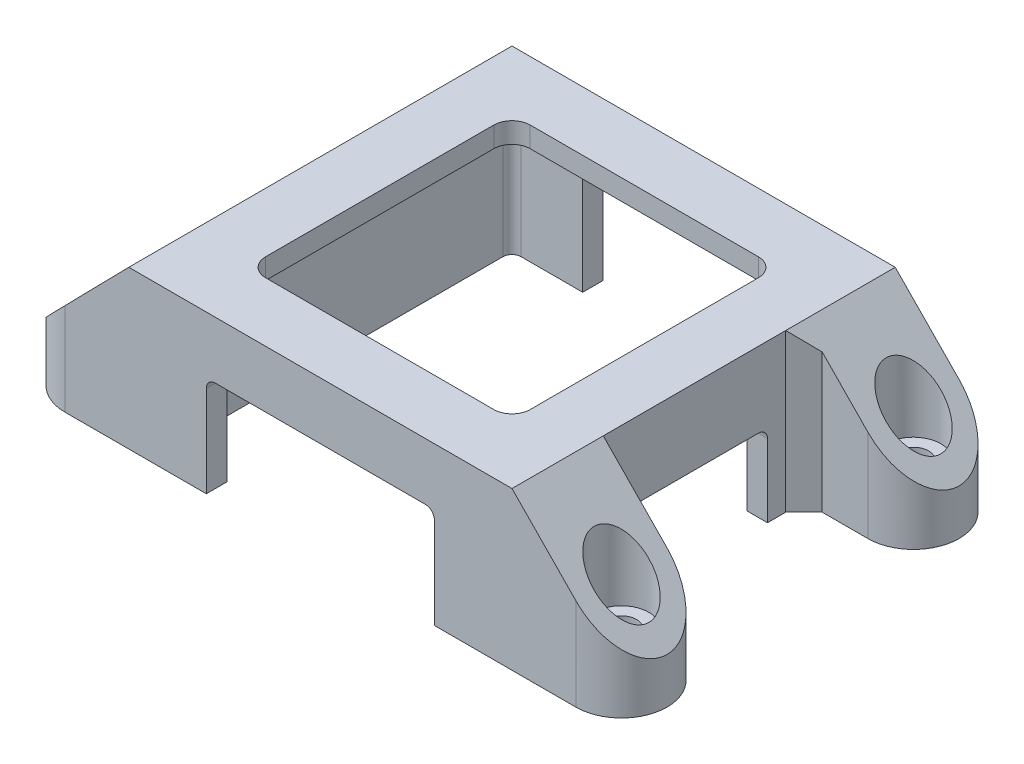
from build123d import *

# Parameters (mm, degrees)
SKETCH1_W           = 37.5
SKETCH1_H           = 37.5
BOSS_EXTRUDE1_DEPTH = 15
SHELL1_T            = 2.25
CUT_EXTRUDE1_REACH  = 52.026
SKETCH2_W           = 25
SKETCH2_H           = 11
CUT_EXTRUDE2_REACH  = 52.026
SKETCH3_W           = 18
SKETCH3_H           = 9
CUT_EXTRUDE3_REACH  = 36.345
SKETCH5_W           = 29
SKETCH5_H           = 29
FILLET1_R           = 2
CUT_EXTRUDE4_REACH  = 52.026
SKETCH6_W           = 22
SKETCH6_H           = 14
FILLET2_R           = 1
SKETCH9_W           = 12
SKETCH9_H           = 10
BOSS_EXTRUDE3_DEPTH = 5
BOSS_EXTRUDE4_DEPTH = 10
SKETCH11_R          = 1.65
CUT_EXTRUDE5_DEPTH  = 5
CUT_EXTRUDE6_REACH  = 42.989
SKETCH12_R          = 3
CUT_EXTRUDE7_REACH  = 44.75
MIRROR3_OUTLINE_R   = 1.65
MIRROR3_DEPTH       = 5
MIRROR3_START       = 5
MIRROR3_2_OUTLINE_R = 3
MIRROR3_2_DEPTH     = 12.25
MIRROR3_START_2     = 27.072732359
MIRROR3_3_OUTLINE_W = 20
MIRROR3_3_OUTLINE_H = 11
MIRROR3_3_DEPTH     = 9.927267641
CHAMFER1_SIZE       = 2
FILLET3_R           = 1


with BuildPart() as part:
    # Sketch1 → Boss-Extrude1 (new body)
    with BuildSketch(Plane(origin=(0, 0, 0), x_dir=(1, 0, 0), z_dir=(0, 1, 0))):
        Rectangle(SKETCH1_W, SKETCH1_H)
    extrude(amount=BOSS_EXTRUDE1_DEPTH)

    # Shell1
    shell1_openings = [part.faces().sort_by_distance(p)[0] for p in [
        (0, 0, 0),
    ]]
    offset(amount=SHELL1_T, openings=shell1_openings, kind=Kind.INTERSECTION)

    # Sketch2 → Cut-Extrude1 (cut, up to next)
    with BuildSketch(Plane.XY.offset(21), mode=Mode.PRIVATE) as cut_extrude1_sk1:
        with Locations((0, 5.5)):
            Rectangle(SKETCH2_W, SKETCH2_H)
    cut_extrude1_tool1 = extrude(cut_extrude1_sk1.sketch, amount=-CUT_EXTRUDE1_REACH, mode=Mode.PRIVATE) & part.part
    add(cut_extrude1_tool1.solids().sort_by_distance((0, 5.5, 21))[0], mode=Mode.SUBTRACT)

    # Sketch3 → Cut-Extrude2 (cut, up to next)
    with BuildSketch(Plane(origin=(21, 0, 0), x_dir=(0, 0, -1), z_dir=(1, 0, 0)), mode=Mode.PRIVATE) as cut_extrude2_sk1:
        with Locations((-2, 4.5)):
            Rectangle(SKETCH3_W, SKETCH3_H)
    cut_extrude2_tool1 = extrude(cut_extrude2_sk1.sketch, amount=-CUT_EXTRUDE2_REACH, mode=Mode.PRIVATE) & part.part
    add(cut_extrude2_tool1.solids().sort_by_distance((21, 4.5, 2))[0], mode=Mode.SUBTRACT)

    # Sketch5 → Cut-Extrude3 (cut, up to next)
    with BuildSketch(Plane(origin=(0, 17.25, 0), x_dir=(1, 0, 0), z_dir=(0, 1, 0)), mode=Mode.PRIVATE) as cut_extrude3_sk1:
        Rectangle(SKETCH5_W, SKETCH5_H)
    cut_extrude3_tool1 = extrude(cut_extrude3_sk1.sketch, amount=-CUT_EXTRUDE3_REACH, mode=Mode.PRIVATE) & part.part
    add(cut_extrude3_tool1.solids().sort_by_distance((0, 17.25, 0))[0], mode=Mode.SUBTRACT)

    # Fillet1
    fillet1_edges = [part.edges().sort_by_distance(p)[0] for p in [
        (14.5, 16.125, -14.5),
        (14.5, 16.125, 14.5),
        (-14.5, 16.125, 14.5),
        (-14.5, 16.125, -14.5),
    ]]
    fillet(fillet1_edges, radius=FILLET1_R)

    # Sketch6 → Cut-Extrude4 (cut, up to next)
    with BuildSketch(Plane(origin=(0, 0, -21), x_dir=(-1, 0, 0), z_dir=(0, 0, -1)), mode=Mode.PRIVATE) as cut_extrude4_sk1:
        with Locations((0, 7)):
            Rectangle(SKETCH6_W, SKETCH6_H)
    cut_extrude4_tool1 = extrude(cut_extrude4_sk1.sketch, amount=-CUT_EXTRUDE4_REACH, mode=Mode.PRIVATE) & part.part
    add(cut_extrude4_tool1.solids().sort_by_distance((0, 7, -21))[0], mode=Mode.SUBTRACT)

    # Fillet2
    fillet2_edges = [part.edges().sort_by_distance(p)[0] for p in [
        (-11, 14, -19.875),
        (11, 14, -19.875),
        (12.5, 11, 19.875),
        (-12.5, 11, 19.875),
        (19.875, 9, 11),
        (19.875, 9, -7),
    ]]
    fillet(fillet2_edges, radius=FILLET2_R)

    # Sketch9 → Boss-Extrude3 (add)
    with BuildSketch(Plane.XZ):
        with Locations((-27, 16)):
            Rectangle(SKETCH9_W, SKETCH9_H)
    boss_extrude3 = extrude(amount=-BOSS_EXTRUDE3_DEPTH)

    # Sketch10 → Boss-Extrude4 (add)
    with BuildSketch(Plane.XY.offset(21)):
        Polygon((-21, 17.25), (-33, 5), (-21, 5), align=None)
    boss_extrude4 = extrude(amount=-BOSS_EXTRUDE4_DEPTH)

    # Sketch11 → Cut-Extrude5 (cut)
    with BuildSketch(Plane.XZ):
        with Locations(Location((-28, 16, 0), (0, 0, 270))):
            Circle(SKETCH11_R)
    cut_extrude5 = extrude(amount=-CUT_EXTRUDE5_DEPTH, mode=Mode.SUBTRACT)

    # Cut-Extrude6: up to this plane
    cut_extrude6_end = Plane(origin=(-21, 17.25, -6.14825064), z_dir=(-0.7143585813751187, 0.6997798348164429, 0))
    # Sketch12 → Cut-Extrude6 (cut, up to the surface)
    with BuildSketch(Plane.XZ.offset(-5), mode=Mode.PRIVATE) as cut_extrude6_sk1:
        with Locations(Location((-28, 16, 0), (0, 0, 270))):
            Circle(SKETCH12_R)
    cut_extrude6_tool1 = split(extrude(cut_extrude6_sk1.sketch, amount=-CUT_EXTRUDE6_REACH, mode=Mode.PRIVATE), bisect_by=cut_extrude6_end, keep=Keep.BOTH, mode=Mode.PRIVATE)
    cut_extrude6 = cut_extrude6_tool1.solids().sort_by_distance((-28, 5, 16))[0]
    add(cut_extrude6, mode=Mode.SUBTRACT)

    # Cut-Extrude7: up to this plane
    cut_extrude7_end = Plane(origin=(-21, 17.25, -6.14825064), z_dir=(-0.7143585813751187, 0.6997798348164429, 0))
    # Sketch13 → Cut-Extrude7 (cut, up to the surface)
    with BuildSketch(Plane.XZ, mode=Mode.PRIVATE) as cut_extrude7_sk1:
        with BuildLine():
            ThreePointArc((-33, 16), (-31.535533906, 19.535533906), (-28, 21))
            Line((-28, 21), (-33, 21))
            Line((-33, 21), (-33, 16))
        make_face()
    cut_extrude7_tool1 = split(extrude(cut_extrude7_sk1.sketch, amount=-CUT_EXTRUDE7_REACH, mode=Mode.PRIVATE), bisect_by=cut_extrude7_end, keep=Keep.BOTH, mode=Mode.PRIVATE)
    # Sketch13 → Cut-Extrude7 (cut, up to the surface)
    with BuildSketch(Plane.XZ, mode=Mode.PRIVATE) as cut_extrude7_sk2:
        with BuildLine():
            Line((-33, 11), (-28, 11))
            ThreePointArc((-28, 11), (-31.535533906, 12.464466094), (-33, 16))
            Line((-33, 16), (-33, 11))
        make_face()
    cut_extrude7_tool2 = split(extrude(cut_extrude7_sk2.sketch, amount=-CUT_EXTRUDE7_REACH, mode=Mode.PRIVATE), bisect_by=cut_extrude7_end, keep=Keep.BOTH, mode=Mode.PRIVATE)
    cut_extrude7 = cut_extrude7_tool1.solids().sort_by_distance((-31.88316, 0, 19.88316))[0] + cut_extrude7_tool2.solids().sort_by_distance((-31.88316, 0, 12.11684))[0]
    add(cut_extrude7, mode=Mode.SUBTRACT)

    # Mirror1: Boss-Extrude3, Boss-Extrude4, Cut-Extrude5, Cut-Extrude6, Cut-Extrude7 across plane
    add(boss_extrude3.mirror(Plane.XY))
    add(boss_extrude4.mirror(Plane.XY))
    add(cut_extrude5.mirror(Plane.XY), mode=Mode.SUBTRACT)
    add(cut_extrude6.mirror(Plane.XY), mode=Mode.SUBTRACT)
    add(cut_extrude7.mirror(Plane.XY), mode=Mode.SUBTRACT)

    # Mirror3: read off the stored shape, not the designer's step
    # Mirror3 outline → Mirror3 (add)
    # profile 1 of 2: a face of its own
    with BuildSketch(Plane(origin=(0, 0, 0), x_dir=(1, 0, 0), z_dir=(0, 1, 0))):
        with BuildLine():
            Line((21, 21), (21, 11))
            Line((21, 11), (28, 11))
            ThreePointArc((28, 11), (33, 16), (28, 21))
            Line((28, 21), (21, 21))
        make_face()
        with Locations((28, 16)):
            Circle(MIRROR3_OUTLINE_R, mode=Mode.SUBTRACT)
    # profile 2 of 2: a face of its own
    with BuildSketch(Plane(origin=(0, 0, 0), x_dir=(1, 0, 0), z_dir=(0, 1, 0))):
        with BuildLine():
            Line((28, -11), (21, -11))
            Line((21, -11), (21, -21))
            Line((21, -21), (28, -21))
            ThreePointArc((28, -21), (33, -16), (28, -11))
        make_face()
        with Locations((28, -16)):
            Circle(MIRROR3_OUTLINE_R, mode=Mode.SUBTRACT)
    extrude(amount=MIRROR3_DEPTH)

    # Mirror3 2 outline → Mirror3 2 (add)
    # profile 1 of 2: a face of its own
    with BuildSketch(Plane(origin=(0, 0, 0), x_dir=(1, 0, 0), z_dir=(0, 1, 0)).offset(MIRROR3_START)):
        with BuildLine():
            Line((21, 21), (21, 11))
            Line((21, 11), (28, 11))
            ThreePointArc((28, 11), (33, 16), (28, 21))
            Line((28, 21), (21, 21))
        make_face()
        with Locations((28, 16)):
            Circle(MIRROR3_2_OUTLINE_R, mode=Mode.SUBTRACT)
    # profile 2 of 2: a face of its own
    with BuildSketch(Plane(origin=(0, 0, 0), x_dir=(1, 0, 0), z_dir=(0, 1, 0)).offset(MIRROR3_START)):
        with BuildLine():
            Line((28, -11), (21, -11))
            Line((21, -11), (21, -21))
            Line((21, -21), (28, -21))
            ThreePointArc((28, -21), (33, -16), (28, -11))
        make_face()
        with Locations((28, -16)):
            Circle(MIRROR3_2_OUTLINE_R, mode=Mode.SUBTRACT)
    extrude(amount=MIRROR3_2_DEPTH)

    # Mirror3 3 outline → Mirror3 3 (cut)
    with BuildSketch(Plane(origin=(0, 0, 0), x_dir=(0.6997798348164427, -0.7143585813751188, 0), z_dir=(0.7143585813751188, 0.6997798348164428, 0)).offset(MIRROR3_START_2)):
        with Locations((11, 16.5)):
            Rectangle(MIRROR3_3_OUTLINE_W, MIRROR3_3_OUTLINE_H)
        with Locations((11, -16.5)):
            Rectangle(MIRROR3_3_OUTLINE_W, MIRROR3_3_OUTLINE_H)
    extrude(amount=MIRROR3_3_DEPTH, mode=Mode.SUBTRACT)

    # Chamfer1
    chamfer1_edges = [part.edges().sort_by_distance(p)[0] for p in [
        (-21, 8.625, 11),
        (-21, 8.625, -11),
        (21, 8.625, -11),
    ]]
    chamfer(chamfer1_edges, length=CHAMFER1_SIZE)

    # Fillet3
    fillet3_edges = [part.edges().sort_by_distance(p)[0] for p in [
        (18.75, 7.5, 18.75),
        (18.75, 7.5, -18.75),
        (-18.75, 7.5, -18.75),
        (-18.75, 7.5, 18.75),
    ]]
    fillet(fillet3_edges, radius=FILLET3_R)


solid = part.part
